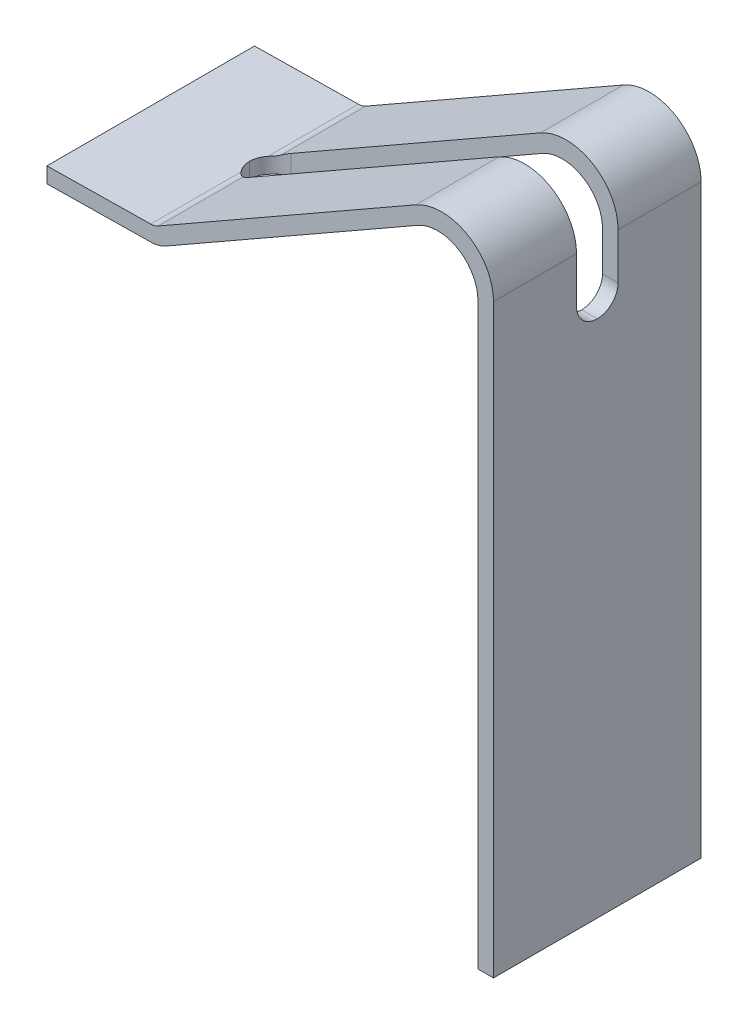
from build123d import *

# Parameters (mm, degrees)
BOSS_EXTRUDE1_DEPTH              = 2
CUT_EXTRUDE2_REACH               = 30.124
CUT_EXTRUDE2_START               = 15
SKETCH3_W                        = 6.7
SKETCH3_H                        = 0.8
CUT_EXTRUDE3_REACH               = 23.248
CUT_EXTRUDE3_OFFSET_FROM_SURFACE = 10
SKETCH4_W                        = 2.662765864
SKETCH4_H                        = 0.8
FILLET1_R                        = 0.4


with BuildPart() as part:
    # Sketch1 → Boss-Extrude1 (new, symmetric)
    with BuildSketch(Plane.XY):
        with BuildLine():
            Line((1.77938838, -1.075884724), (2.07938838, -1.075884724))
            Line((2.07938838, -1.075884724), (2.07938838, 10.209972433))
            ThreePointArc((2.07938838, 10.209972433), (1.58135883, 11.074857205), (0.583337044, 11.078265628))
            Line((0.583337044, 11.078265628), (-4.380611082, 8.242388166))
            ThreePointArc((-4.380611082, 8.242388166), (-4.45031283, 8.2134957), (-4.525019051, 8.202908502))
            Line((-4.525019051, 8.202908502), (-6.525019051, 8.173522453))
            Line((-6.525019051, 8.173522453), (-6.52061162, 7.873554831))
            Line((-6.52061162, 7.873554831), (-4.52061162, 7.902940879))
            ThreePointArc((-4.52061162, 7.902940879), (-4.371199177, 7.924115276), (-4.231795681, 7.981900208))
            Line((-4.231795681, 7.981900208), (0.619506411, 10.753423582))
            ThreePointArc((0.619506411, 10.753423582), (1.393268277, 10.750781047), (1.77938838, 10.080239717))
            Line((1.77938838, 10.080239717), (1.77938838, -1.075884724))
        make_face()
    extrude(amount=BOSS_EXTRUDE1_DEPTH, both=True)

    # Cut-Extrude2: up to this plane
    cut_extrude2_end = Plane(origin=(0.619506411, 10.753423582, 2), z_dir=(-0.49605133620388303, 0.8682931946355115, 0))
    # Sketch3 → Cut-Extrude2 (cut, up to the surface)
    with BuildSketch(Plane(origin=(0, 0, 0), x_dir=(1, 0, 0), z_dir=(0, 1, 0)).offset(CUT_EXTRUDE2_START), mode=Mode.PRIVATE) as cut_extrude2_sk1:
        with Locations((-1.27061162, 0)):
            Rectangle(SKETCH3_W, SKETCH3_H)
    cut_extrude2_tool1 = split(extrude(cut_extrude2_sk1.sketch, amount=-CUT_EXTRUDE2_REACH, mode=Mode.PRIVATE), bisect_by=cut_extrude2_end, keep=Keep.BOTH, mode=Mode.PRIVATE)
    add(cut_extrude2_tool1.solids().sort_by_distance((-1.270612, 15, 0))[0], mode=Mode.SUBTRACT)

    # Cut-Extrude3: up to this face of the body (flat: up to its plane, moved by the offset)
    cut_extrude3_end = Plane(part.part.faces().sort_by_distance((1.92938838, -1.075884724, 0))[0]).offset(-CUT_EXTRUDE3_OFFSET_FROM_SURFACE)
    # Sketch4 → Cut-Extrude3 (cut, up to the picked face)
    with BuildSketch(Plane(origin=(-4.479253053, 7.840529112, 0), x_dir=(0.8682931946355115, 0.49605133620388303, 0), z_dir=(-0.49605133620388303, 0.8682931946355115, 0)), mode=Mode.PRIVATE) as cut_extrude3_sk1:
        with Locations((7.203546269, 0)):
            Rectangle(SKETCH4_W, SKETCH4_H)
    cut_extrude3_tool1 = split(extrude(cut_extrude3_sk1.sketch, amount=-CUT_EXTRUDE3_REACH, mode=Mode.PRIVATE), bisect_by=cut_extrude3_end, keep=Keep.BOTH, mode=Mode.PRIVATE)
    add(cut_extrude3_tool1.solids().sort_by(Axis((1.775537, 11.413858, 0), (0.49605133620388303, -0.8682931946355115, 0)))[0], mode=Mode.SUBTRACT)

    # Fillet1
    fillet1_edges = [part.edges().sort_by_distance(p)[0] for p in [
        (-4.62061162, 8.051487767, -0.4),
        (-4.62061162, 8.051487767, 0.4),
        (1.92938838, 8.924115276, -0.4),
        (1.92938838, 8.924115276, 0.4),
    ]]
    fillet(fillet1_edges, radius=FILLET1_R - 0.0001)  # a hair under: the kernel refuses the full size


solid = part.part
